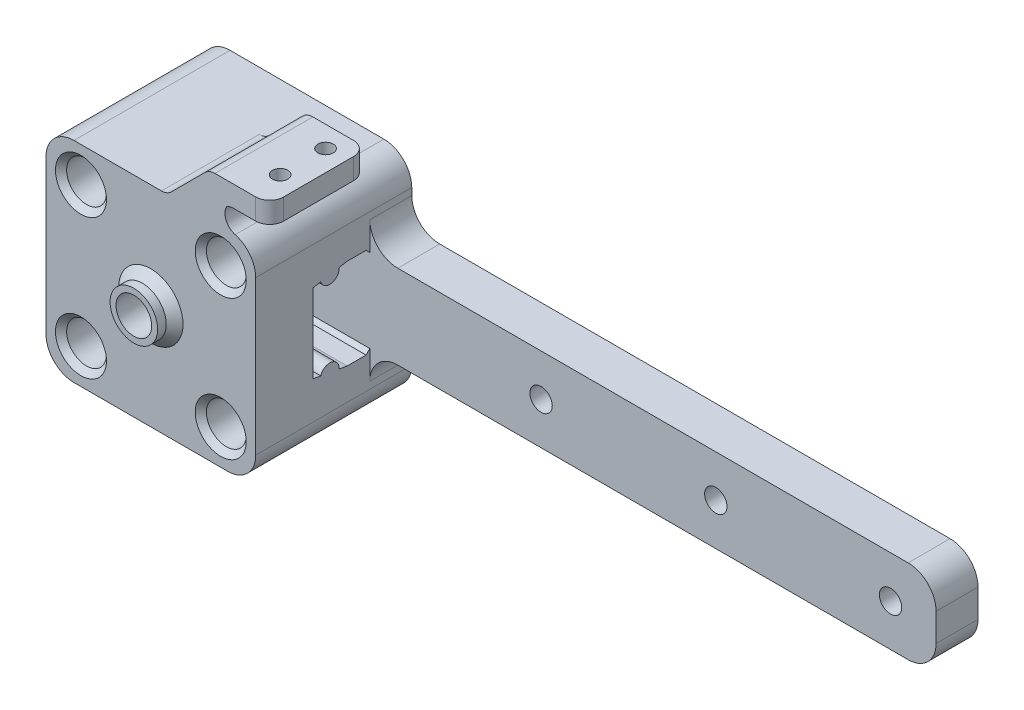
from build123d import *

# Parameters (mm, degrees)
SKETCH1_W                  = 30
SKETCH1_H                  = 30
SKETCH1_R                  = 1.6
SKETCH1_W_2                = 81.01
SKETCH1_H_2                = 12
BOSS_EXTRUDE1_DEPTH        = 6
SKETCH1_3_W                = 30
SKETCH1_3_H                = 30
SKETCH1_3_R                = 1.6
BOSS_EXTRUDE2_DEPTH        = 22.33
CUT_EXTRUDE1_DEPTH         = 88.671255266
SKETCH3_R                  = 2.55
CUT_EXTRUDE2_DEPTH         = 8
CUT_EXTRUDE3_DEPTH         = 4.5
SKETCH6_R                  = 5
CUT_EXTRUDE5_DEPTH         = 8.6
SKETCH7_R                  = 1.6
CUT_EXTRUDE6_DEPTH         = 112.183402538
SKETCH8_R                  = 2.85
CUT_EXTRUDE7_DEPTH         = 18
BOSS_EXTRUDE3_START        = 2.43
SKETCH9_R                  = 3.4
SKETCH9_R_2                = 2.55
BOSS_EXTRUDE3_DEPTH        = 2.43
CHAMFER1_SIZE              = 1.2
FILLET3_R                  = 4
CHAMFER2_SIZE              = 0.8
BOSS_EXTRUDE6_DEPTH        = 14
CUT_EXTRUDE10_REACH        = 116.661
SKETCH17_R                 = 1.1
FILLET5_R                  = 2
CUT_EXTRUDE11_DEPTH        = 3
CHAMFER3_SIZE              = 0.8
LPATTERN2_COUNT            = 3
LPATTERN2_PITCH            = 25
CHAMFER3_OF_LPATTERN2_SIZE = 0.8


with BuildPart() as part:
    # Sketch1 → Boss-Extrude1 (new body)
    # profile 1 of 2: a face of its own
    with BuildSketch(Plane.XY):
        with Locations((10, 10)):
            Rectangle(SKETCH1_W, SKETCH1_H)
        with Locations((20, 0)):
            Circle(SKETCH1_R, mode=Mode.SUBTRACT)
        with Locations((20, 20)):
            Circle(SKETCH1_R, mode=Mode.SUBTRACT)
        with Locations((0, 20)):
            Circle(SKETCH1_R, mode=Mode.SUBTRACT)
        Circle(SKETCH1_R, mode=Mode.SUBTRACT)
    # profile 2 of 2: a face of its own
    with BuildSketch(Plane.XY):
        with Locations((65.505, 10)):
            Rectangle(SKETCH1_W_2, SKETCH1_H_2)
    extrude(amount=BOSS_EXTRUDE1_DEPTH)

    # Sketch1<3> → Boss-Extrude2 (add)
    with BuildSketch(Plane.XY):
        with Locations((10, 10)):
            Rectangle(SKETCH1_3_W, SKETCH1_3_H)
        with Locations((20, 0)):
            Circle(SKETCH1_3_R, mode=Mode.SUBTRACT)
        with Locations((20, 20)):
            Circle(SKETCH1_3_R, mode=Mode.SUBTRACT)
        with Locations((0, 20)):
            Circle(SKETCH1_3_R, mode=Mode.SUBTRACT)
        Circle(SKETCH1_3_R, mode=Mode.SUBTRACT)
    extrude(amount=BOSS_EXTRUDE2_DEPTH)

    # Sketch2 → Cut-Extrude1 (cut, through all)
    with BuildSketch(Plane(origin=(25, 0, 0), x_dir=(0, 0, -1), z_dir=(1, 0, 0))):
        with BuildLine():
            Line((-6.54075, 16.488632043), (-9.2445, 16.488632043))
            Line((-9.2445, 16.488632043), (-10.381879417, 16.288081364))
            ThreePointArc((-10.381879417, 16.288081364), (-11.49719937, 14.886920062), (-13.024482689, 15.822119108))
            Line((-13.024482689, 15.822119108), (-14.11125, 15.630492709))
            Line((-14.11125, 15.630492709), (-14.11125, 4.368771376))
            Line((-14.11125, 4.368771376), (-13.024482689, 4.177144977))
            ThreePointArc((-13.024482689, 4.177144977), (-11.49719937, 5.112344024), (-10.381879417, 3.711182721))
            Line((-10.381879417, 3.711182721), (-9.2445, 3.510632043))
            Line((-9.2445, 3.510632043), (-6.54075, 3.510632043))
            Line((-6.54075, 3.510632043), (-6, 4.051382043))
            Line((-6, 4.051382043), (-6, 15.947882043))
            Line((-6, 15.947882043), (-6.54075, 16.488632043))
        make_face()
    extrude(amount=-CUT_EXTRUDE1_DEPTH, mode=Mode.SUBTRACT)

    # Sketch3 → Cut-Extrude2 (cut)
    with BuildSketch(Plane.XY.offset(22.33)):
        with Locations((10, 10)):
            Circle(SKETCH3_R)
    extrude(amount=-CUT_EXTRUDE2_DEPTH, mode=Mode.SUBTRACT)

    # Sketch5 → Cut-Extrude3 (cut)
    with BuildSketch(Plane(origin=(0, 0, 14.11125), x_dir=(-1, 0, 0), z_dir=(0, 0, -1))):
        Polygon((-5.32346282, 10), (-7.66173141, 14.05), (-12.33826859, 14.05), (-14.67653718, 10), (-12.33826859, 5.95), (-7.66173141, 5.95), align=None)
    extrude(amount=-CUT_EXTRUDE3_DEPTH, mode=Mode.SUBTRACT)

    # Sketch6 → Cut-Extrude5 (cut)
    with BuildSketch(Plane(origin=(0, 0, 0), x_dir=(-1, 0, 0), z_dir=(0, 0, -1))):
        with Locations((-10, 10)):
            Circle(SKETCH6_R)
    extrude(amount=-CUT_EXTRUDE5_DEPTH, mode=Mode.SUBTRACT)

    # Sketch7 → Cut-Extrude6 (cut, through all)
    with BuildSketch(Plane(origin=(0, 0, 0), x_dir=(-1, 0, 0), z_dir=(0, 0, -1))):
        with BuildLine():
            ThreePointArc((-101.1, 10), (-99.5, 8.4), (-97.9, 10))
            Line((-97.9, 10), (-101.1, 10))
        make_face()
        with BuildLine():
            Line((-101.1, 10), (-97.9, 10))
            ThreePointArc((-97.9, 10), (-99.5, 11.6), (-101.1, 10))
        make_face()
        with Locations((-74.5, 10)):
            Circle(SKETCH7_R)
        with Locations((-49.5, 10)):
            Circle(SKETCH7_R)
    extrude(amount=-CUT_EXTRUDE6_DEPTH, mode=Mode.SUBTRACT)

    # Sketch8 → Cut-Extrude7 (cut)
    with BuildSketch(Plane.XY.offset(22.33)):
        with Locations((20, 20)):
            Circle(SKETCH8_R)
        with Locations((20, 0)):
            Circle(SKETCH8_R)
        Circle(SKETCH8_R)
        with Locations((0, 20)):
            Circle(SKETCH8_R)
    extrude(amount=-CUT_EXTRUDE7_DEPTH, mode=Mode.SUBTRACT)

    # Sketch9 → Boss-Extrude3 (add)
    with BuildSketch(Plane.XY.offset(22.33).offset(BOSS_EXTRUDE3_START)):
        with Locations(Location((10, 10, 0), (0, 0, 180))):
            Circle(SKETCH9_R)
        with Locations((10, 10)):
            Circle(SKETCH9_R_2, mode=Mode.SUBTRACT)
    extrude(amount=-BOSS_EXTRUDE3_DEPTH)

    # Chamfer1
    chamfer1_edges = [part.edges().sort_by_distance(p)[0] for p in [
        (13.4, 10, 22.33),
    ]]
    chamfer(chamfer1_edges, length=CHAMFER1_SIZE)

    # Fillet3
    fillet3_edges = [part.edges().sort_by_distance(p)[0] for p in [
        (-5, -5, 11.165),
        (-5, 25, 11.165),
        (25, 25, 11.165),
        (25, 16, 3),
        (106.01, 16, 3),
        (106.01, 4, 3),
        (25, 4, 3),
        (25, -5, 11.165),
    ]]
    fillet(fillet3_edges, radius=FILLET3_R)

    # Chamfer2
    chamfer2_edges = [part.edges().sort_by_distance(p)[0] for p in [
        (-2.85, 20, 22.33),
        (-2.85, 0, 22.33),
        (17.15, 0, 22.33),
        (17.15, 20, 22.33),
    ]]
    chamfer(chamfer2_edges, length=CHAMFER2_SIZE)

    # Sketch15 → Boss-Extrude6 (add)
    with BuildSketch(Plane.XY.offset(22.33)):
        Polygon((18.343145751, 31), (12.343145751, 25), (18, 25), (21, 28), (27, 28), (27, 31), align=None)
    extrude(amount=-BOSS_EXTRUDE6_DEPTH)

    # Sketch17 → Cut-Extrude10 (cut, up to next)
    with BuildSketch(Plane(origin=(0, 31, 0), x_dir=(1, 0, 0), z_dir=(0, 1, 0)), mode=Mode.PRIVATE) as cut_extrude10_sk1:
        with Locations(Location((24, -11.33, 0), (0, 0, 180))):
            Circle(SKETCH17_R)
    cut_extrude10_tool1 = extrude(cut_extrude10_sk1.sketch, amount=-CUT_EXTRUDE10_REACH, mode=Mode.PRIVATE) & part.part
    # Sketch17 → Cut-Extrude10 (cut, up to next)
    with BuildSketch(Plane(origin=(0, 31, 0), x_dir=(1, 0, 0), z_dir=(0, 1, 0)), mode=Mode.PRIVATE) as cut_extrude10_sk2:
        with Locations(Location((24, -17.83, 0), (0, 0, 180))):
            Circle(SKETCH17_R)
    cut_extrude10_tool2 = extrude(cut_extrude10_sk2.sketch, amount=-CUT_EXTRUDE10_REACH, mode=Mode.PRIVATE) & part.part
    add(cut_extrude10_tool1.solids().sort_by_distance((24, 31, 11.33))[0], mode=Mode.SUBTRACT)
    add(cut_extrude10_tool2.solids().sort_by_distance((24, 31, 17.83))[0], mode=Mode.SUBTRACT)

    # Fillet5
    # the kernel refuses this fillet: 2 mm, written as the material it adds along each edge
    with BuildSketch(Plane(origin=(21, 28, 22.33), x_dir=(-0.7071067811865475, -0.7071067811865475, 0), z_dir=(0, 0, -1))) as fillet5_piece_1:
        with BuildLine():
            CenterArc((FILLET5_R * 0.414213562373, -FILLET5_R), FILLET5_R, 90, 45)
            Line((-FILLET5_R * 0.292893218813, -FILLET5_R * 0.292893218813), (0, 0))
            Line((0, 0), (FILLET5_R * 0.414213562373, 0))
        make_face()
    extrude(amount=14)
    with BuildSketch(Plane(origin=(12.343145751, 25, 22.33), x_dir=(-1, 0, 0), z_dir=(0, 0, -1))) as fillet5_piece_2:
        with BuildLine():
            CenterArc((FILLET5_R * 0.414213562373, FILLET5_R), FILLET5_R, 225, 45)
            Line((-FILLET5_R * 0.292893218813, FILLET5_R * 0.292893218813), (0, 0))
            Line((0, 0), (FILLET5_R * 0.414213562373, 0))
        make_face()
    extrude(amount=14)
    with BuildSketch(Plane(origin=(18, 25, 22.33), x_dir=(0.9993539414176275, -0.03594022500003582, 0), z_dir=(0, 0, -1))) as fillet5_piece_3:
        with BuildLine():
            CenterArc((4.541773641, -1.944797545), FILLET5_R, 103.492916805, 119.447416414)
            Line((3.07764659, -3.307270289), (2.931233885, -3.443517564))
            Line((2.931233885, -3.443517564), (-0.146412705, -0.136247274))
            Line((-0.146412705, -0.136247274), (0.007188045, 0.199870788))
            ThreePointArc((0.007188045, 0.199870788), (3.005249869, 0.092050113), (4.028458305, 0.194479755))
            Line((4.028458305, 0.194479755), (4.075123335, 0))
        make_face()
    extrude(amount=14)
    # the kernel refuses this fillet: 2 mm, written as the material it takes off along each edge
    with BuildSketch(Plane(origin=(27, 23, 22.33), x_dir=(-1, 0, 0), z_dir=(0, 1, 0))) as fillet5_2_piece_1:
        with BuildLine():
            CenterArc((FILLET5_R, -FILLET5_R), FILLET5_R, 90, 90)
            Line((0, -FILLET5_R), (0, 0))
            Line((0, 0), (FILLET5_R, 0))
        make_face()
    extrude(amount=13, mode=Mode.SUBTRACT)
    with BuildSketch(Plane(origin=(27, 23, 8.33), x_dir=(-1, 0, 0), z_dir=(0, 1, 0))) as fillet5_2_piece_2:
        with BuildLine():
            CenterArc((FILLET5_R, FILLET5_R), FILLET5_R, 180, 90)
            Line((0, FILLET5_R), (0, 0))
            Line((0, 0), (FILLET5_R, 0))
        make_face()
    extrude(amount=13, mode=Mode.SUBTRACT)
    with BuildSketch(Plane(origin=(18.343145751, 31, 24.401067812), x_dir=(-0.7071067811865476, -0.7071067811865476, 0), z_dir=(0, 0, -1))) as fillet5_2_piece_3:
        with BuildLine():
            CenterArc((FILLET5_R * 0.414213562373, -FILLET5_R), FILLET5_R, 90, 45)
            Line((-FILLET5_R * 0.292893218813, -FILLET5_R * 0.292893218813), (0, 0))
            Line((0, 0), (FILLET5_R * 0.414213562373, 0))
        make_face()
    extrude(amount=18.142135624, mode=Mode.SUBTRACT)

    # Sketch10 → Cut-Extrude11 (cut)
    with BuildSketch(Plane(origin=(0, 0, 0), x_dir=(-1, 0, 0), z_dir=(0, 0, -1))):
        Polygon((-97.883419246, 12.8), (-101.116580754, 12.8), (-102.733161507, 10), (-101.116580754, 7.2), (-97.883419246, 7.2), (-96.266838493, 10), align=None)
    cut_extrude11 = extrude(amount=-CUT_EXTRUDE11_DEPTH, mode=Mode.SUBTRACT)

    # Chamfer3
    chamfer3_edges = [part.edges().sort_by_distance(p)[0] for p in [
        (97.075128869, 11.4, 0),
        (99.5, 12.8, 0),
        (101.924871131, 11.4, 0),
        (101.924871131, 8.6, 0),
        (99.5, 7.2, 0),
        (97.075128869, 8.6, 0),
    ]]
    chamfer(chamfer3_edges, length=CHAMFER3_SIZE)

    # LPattern2: Cut-Extrude11 ×3
    with Locations(*[(-i * LPATTERN2_PITCH, 0, 0) for i in range(1, LPATTERN2_COUNT)]):
        add(cut_extrude11, mode=Mode.SUBTRACT)

    # Chamfer3 of LPattern2
    chamfer3_of_lpattern2_edges = [part.edges().sort_by_distance(p)[0] for p in [
        (72.075128869, 11.4, 0),
        (74.5, 12.8, 0),
        (76.924871131, 11.4, 0),
        (76.924871131, 8.6, 0),
        (74.5, 7.2, 0),
        (72.075128869, 8.6, 0),
        (47.075128869, 11.4, 0),
        (49.5, 12.8, 0),
        (51.924871131, 11.4, 0),
        (51.924871131, 8.6, 0),
        (49.5, 7.2, 0),
        (47.075128869, 8.6, 0),
    ]]
    chamfer(chamfer3_of_lpattern2_edges, length=CHAMFER3_OF_LPATTERN2_SIZE)


solid = part.part
